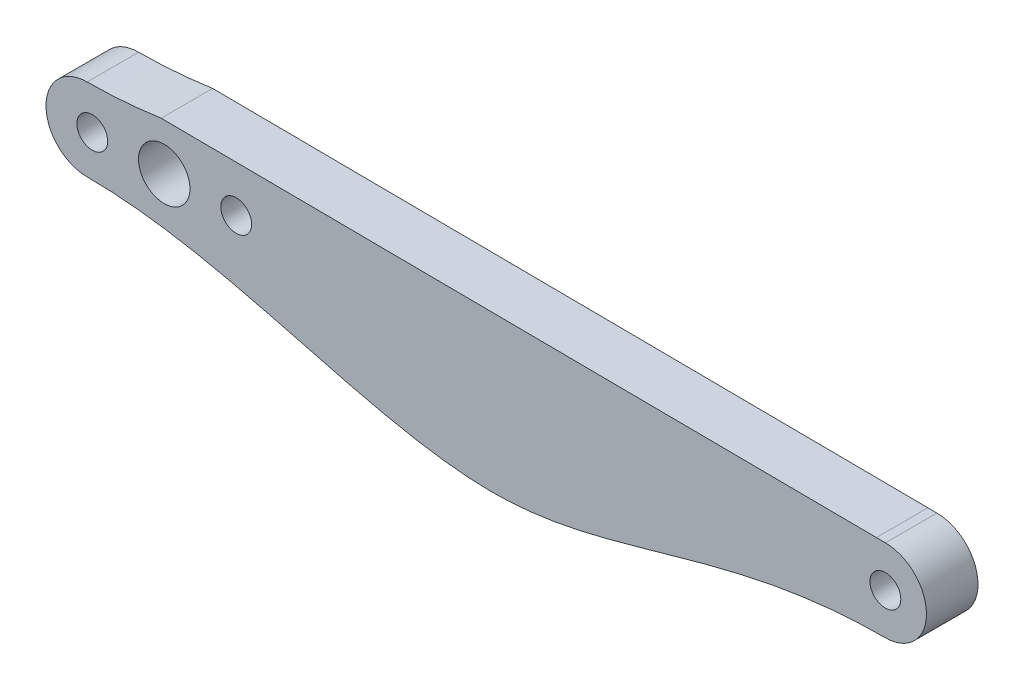
from build123d import *
from build123d.topology import SkipClean

# Parameters (mm, degrees)
SKETCH1_R             = 1.5
BOSS_EXTRUDE1_DEPTH   = 5
BOSS_EXTRUDE3_DEPTH   = 5
SKETCH4_R             = 2.5
CUT_EXTRUDE2_DEPTH    = 5
BOSS_EXTRUDE4_DEPTH   = 5
BOSS_EXTRUDE4_2_DEPTH = 5
SKETCH7_R             = 1.5
SKETCH7_R_2           = 2.5
BOSS_EXTRUDE5_DEPTH   = 0.01
CUT_EXTRUDE3_DEPTH    = 10
SKETCH10_R            = 1.5
CUT_EXTRUDE4_DEPTH    = 10


with BuildPart() as part:
    # Sketch1 → Boss-Extrude1 (new body)
    with BuildSketch(Plane.XY):
        with BuildLine():
            Line((0, -4), (-70.14, -4))
            ThreePointArc((-70.14, -4), (-74.14, 0), (-70.14, 4))
            Line((-70.14, 4), (0, 4))
            ThreePointArc((0, 4), (4, 0), (0, -4))
        make_face()
        with Locations((-70.14, 0)):
            Circle(SKETCH1_R, mode=Mode.SUBTRACT)
        Circle(SKETCH1_R, mode=Mode.SUBTRACT)
    extrude(amount=BOSS_EXTRUDE1_DEPTH)

    # Sketch3 → Boss-Extrude3 (add)
    with BuildSketch(Plane.XY):
        with BuildLine():
            Line((-70.14, -4), (-77.64, -4))
            ThreePointArc((-77.64, -4), (-81.64, 0), (-77.64, 4))
            Line((-77.64, 4), (-70.14, 4))
            ThreePointArc((-70.14, 4), (-66.14, 0), (-70.14, -4))
        make_face()
    extrude(amount=BOSS_EXTRUDE3_DEPTH)

    # Sketch4 → Cut-Extrude2 (cut)
    with BuildSketch(Plane(origin=(0, 0, 0), x_dir=(-1, 0, 0), z_dir=(0, 0, -1))):
        with Locations((70.14, 0)):
            Circle(SKETCH4_R)
    extrude(amount=-CUT_EXTRUDE2_DEPTH, mode=Mode.SUBTRACT)



with BuildPart() as body_2:
    # Sketch5 → Boss-Extrude4 (new body)
    with BuildSketch(Plane.XY.offset(5)):
        with BuildLine():
            Line((0, -4), (-77.64, -4))
            add(Edge.make_bspline(
                [(-77.64, -4), (-63.527561679, -4), (-37.041969255, -17.709059975), (-15.820527041, -4), (0, -4)],
                knots=[0, 0, 0, 0, 0.514247309, 1, 1, 1, 1], degree=3))
        make_face()
    extrude(amount=-BOSS_EXTRUDE4_DEPTH)


with BuildPart() as body_3:
    # Sketch5 → Boss-Extrude4 2 (new body)
    with BuildSketch(Plane.XY.offset(5)):
        with BuildLine():
            add(Edge.make_bspline(
                [(-77.64, 4), (-63.527561679, 4), (-37.041969255, 17.709059975), (-15.820527041, 4), (0, 4)],
                knots=[0, 0, 0, 0, 0.514247309, 1, 1, 1, 1], degree=3))
            Line((-77.64, 4), (0, 4))
        make_face()
    extrude(amount=-BOSS_EXTRUDE4_2_DEPTH)


with BuildPart() as part_1:
    with SkipClean():  # the faces are left unmerged after this step: merging them gives an invalid solid
        add(part.part)

        add(body_2.part)  # Boss-Extrude5 merges body 2

        add(body_3.part)  # Boss-Extrude5 merges body 3
        # Sketch7 → Boss-Extrude5 (add)
        with BuildSketch(Plane.XY.offset(5)):
            with BuildLine():
                add(Edge.make_bspline(
                    [(0, 4), (-15.820527041, 4), (-37.041969255, 17.709059975), (-63.527561679, 4), (-77.64, 4)],
                    knots=[0, 0, 0, 0, 0.485752691, 1, 1, 1, 1], degree=3))
                ThreePointArc((-77.64, 4), (-81.64, 0), (-77.64, -4))
                add(Edge.make_bspline(
                    [(-77.64, -4), (-63.527561679, -4), (-37.041969255, -17.709059975), (-15.820527041, -4), (0, -4)],
                    knots=[0, 0, 0, 0, 0.514247309, 1, 1, 1, 1], degree=3))
                ThreePointArc((0, -4), (4, 0), (0, 4))
            make_face()
            Circle(SKETCH7_R, mode=Mode.SUBTRACT)
            with Locations((-70.14, 0)):
                Circle(SKETCH7_R_2, mode=Mode.SUBTRACT)
        extrude(amount=BOSS_EXTRUDE5_DEPTH)
    add(part_1.part.scale(1), mode=Mode.REPLACE)  # the faces are merged on a copy

    # Sketch9 → Cut-Extrude3 (cut)
    with BuildSketch(Plane.XY.offset(5.01)):
        with BuildLine():
            add(Edge.make_bspline(
                [(-0.876672038, 4.006820197), (-16.204235996, 4.245362878), (-35.408867191, 16.400266247), (-58.905371653, 6.201116002), (-70.440504523, 4.548002129)],
                knots=[0.009030481, 0.009030481, 0.009030481, 0.009030481, 0.485752691, 0.911971345, 0.911971345, 0.911971345, 0.911971345], degree=3))
            Line((-70.440504523, 4.548002129), (-70.104638549, 4.545389211))
            Line((-70.104638549, 4.545389211), (-0.876672038, 4.006820197))
        make_face()
    extrude(amount=-CUT_EXTRUDE3_DEPTH, mode=Mode.SUBTRACT)

    # Sketch10 → Cut-Extrude4 (cut)
    with BuildSketch(Plane.XY.offset(5.01)):
        with Locations((-63.14, 0)):
            Circle(SKETCH10_R)
        with Locations((-77.14, 0)):
            Circle(SKETCH10_R)
    extrude(amount=-CUT_EXTRUDE4_DEPTH, mode=Mode.SUBTRACT)


solid = part_1.part
